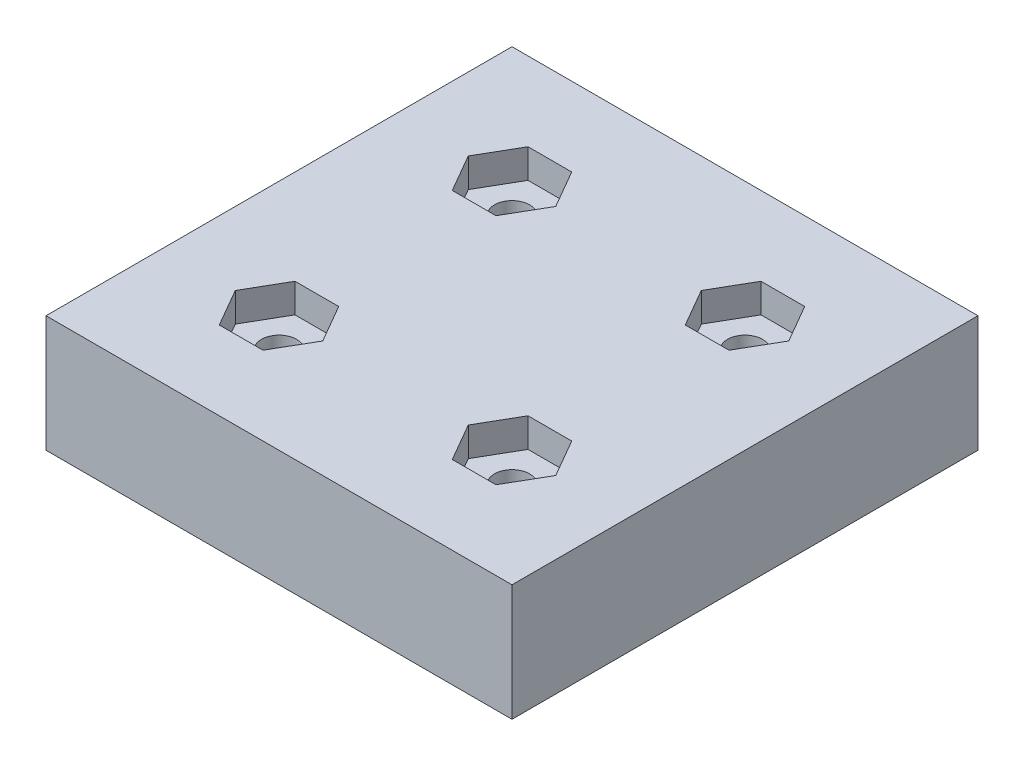
from build123d import *

# Parameters (mm, degrees)
SKETCH1_W           = 40
SKETCH1_H           = 40
SKETCH1_R           = 1.5
BOSS_EXTRUDE1_DEPTH = 10
CUT_EXTRUDE1_DEPTH  = 2.5


with BuildPart() as part:
    # Sketch1 → Boss-Extrude1 (new body)
    with BuildSketch(Plane(origin=(0, 0, 0), x_dir=(1, 0, 0), z_dir=(0, 1, 0))):
        with Locations((20, 20)):
            Rectangle(SKETCH1_W, SKETCH1_H)
        with Locations((10, 30)):
            Circle(SKETCH1_R, mode=Mode.SUBTRACT)
        with Locations((30, 30)):
            Circle(SKETCH1_R, mode=Mode.SUBTRACT)
        with Locations((30, 10)):
            Circle(SKETCH1_R, mode=Mode.SUBTRACT)
        with Locations((10, 10)):
            Circle(SKETCH1_R, mode=Mode.SUBTRACT)
    extrude(amount=BOSS_EXTRUDE1_DEPTH)

    # Sketch2 → Cut-Extrude1 (cut)
    with BuildSketch(Plane(origin=(0, 10, 0), x_dir=(1, 0, 0), z_dir=(0, 1, 0))):
        Polygon((13.75277675, 10), (11.876388375, 13.25), (8.123611625, 13.25), (6.24722325, 10), (8.123611625, 6.75), (11.876388375, 6.75), align=None)
        Polygon((26.24722325, 10), (28.123611625, 6.75), (31.876388375, 6.75), (33.75277675, 10), (31.876388375, 13.25), (28.123611625, 13.25), align=None)
        Polygon((26.24722325, 30), (28.123611625, 26.75), (31.876388375, 26.75), (33.75277675, 30), (31.876388375, 33.25), (28.123611625, 33.25), align=None)
        Polygon((13.75277675, 30), (11.876388375, 33.25), (8.123611625, 33.25), (6.24722325, 30), (8.123611625, 26.75), (11.876388375, 26.75), align=None)
    extrude(amount=-CUT_EXTRUDE1_DEPTH, mode=Mode.SUBTRACT)


solid = part.part
